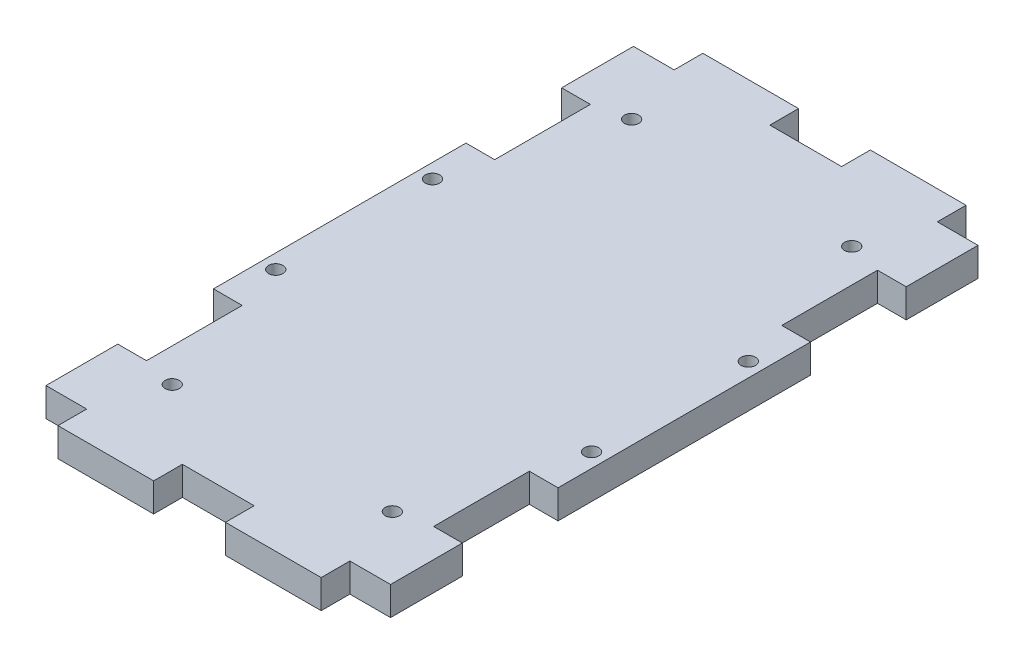
from build123d import *

# Parameters (mm, degrees)
ESQUISSE1_W             = 72
ESQUISSE1_H             = 122.76
BOSS_EXTRU_1_DEPTH      = 6
ESQUISSE2_W             = 20
ESQUISSE2_H             = 6
BOSS_EXTRU_2_DEPTH      = 6
ESQUISSE3_W             = 6
ESQUISSE3_H             = 20
ENL_V_MAT_EXTRU_1_DEPTH = 6
ESQUISSE4_R             = 1.5
ENL_V_MAT_EXTRU_2_DEPTH = 6


with BuildPart() as part:
    # Esquisse1 → Boss.-Extru.1 (new body)
    with BuildSketch(Plane(origin=(0, 0, 0), x_dir=(1, 0, 0), z_dir=(0, 1, 0))):
        Rectangle(ESQUISSE1_W, ESQUISSE1_H)
    extrude(amount=BOSS_EXTRU_1_DEPTH)

    # Esquisse2 → Boss.-Extru.2 (add)
    with BuildSketch(Plane(origin=(0, 6, 0), x_dir=(1, 0, 0), z_dir=(0, 1, 0))):
        with Locations((-17.5, 64.38)):
            Rectangle(ESQUISSE2_W, ESQUISSE2_H)
        with Locations((17.5, 64.38)):
            Rectangle(ESQUISSE2_W, ESQUISSE2_H)
        with Locations((17.5, -64.38)):
            Rectangle(ESQUISSE2_W, ESQUISSE2_H)
        with Locations((-17.5, -64.38)):
            Rectangle(ESQUISSE2_W, ESQUISSE2_H)
    extrude(amount=-BOSS_EXTRU_2_DEPTH)

    # Esquisse3 → Enlèv. mat.-Extru.1 (cut)
    with BuildSketch(Plane(origin=(0, 6, 0), x_dir=(1, 0, 0), z_dir=(0, 1, 0))):
        with Locations((-33, 36.38)):
            Rectangle(ESQUISSE3_W, ESQUISSE3_H)
        with Locations((-33, -36.38)):
            Rectangle(ESQUISSE3_W, ESQUISSE3_H)
        with Locations((33, -36.38)):
            Rectangle(ESQUISSE3_W, ESQUISSE3_H)
        with Locations((33, 36.38)):
            Rectangle(ESQUISSE3_W, ESQUISSE3_H)
    extrude(amount=-ENL_V_MAT_EXTRU_1_DEPTH, mode=Mode.SUBTRACT)

    # Esquisse4 → Enlèv. mat.-Extru.2 (cut)
    with BuildSketch(Plane(origin=(0, 6, 0), x_dir=(1, 0, 0), z_dir=(0, 1, 0))):
        with Locations((-33, 16.38)):
            Circle(ESQUISSE4_R)
        with Locations((-33, -16.38)):
            Circle(ESQUISSE4_R)
        with Locations((33, -16.38)):
            Circle(ESQUISSE4_R)
        with Locations((33, 16.38)):
            Circle(ESQUISSE4_R)
        with Locations((23, 48)):
            Circle(ESQUISSE4_R)
        with Locations((23, -48)):
            Circle(ESQUISSE4_R)
        with Locations((-23, -48)):
            Circle(ESQUISSE4_R)
        with Locations((-23, 48)):
            Circle(ESQUISSE4_R)
    extrude(amount=-ENL_V_MAT_EXTRU_2_DEPTH, mode=Mode.SUBTRACT)


solid = part.part
